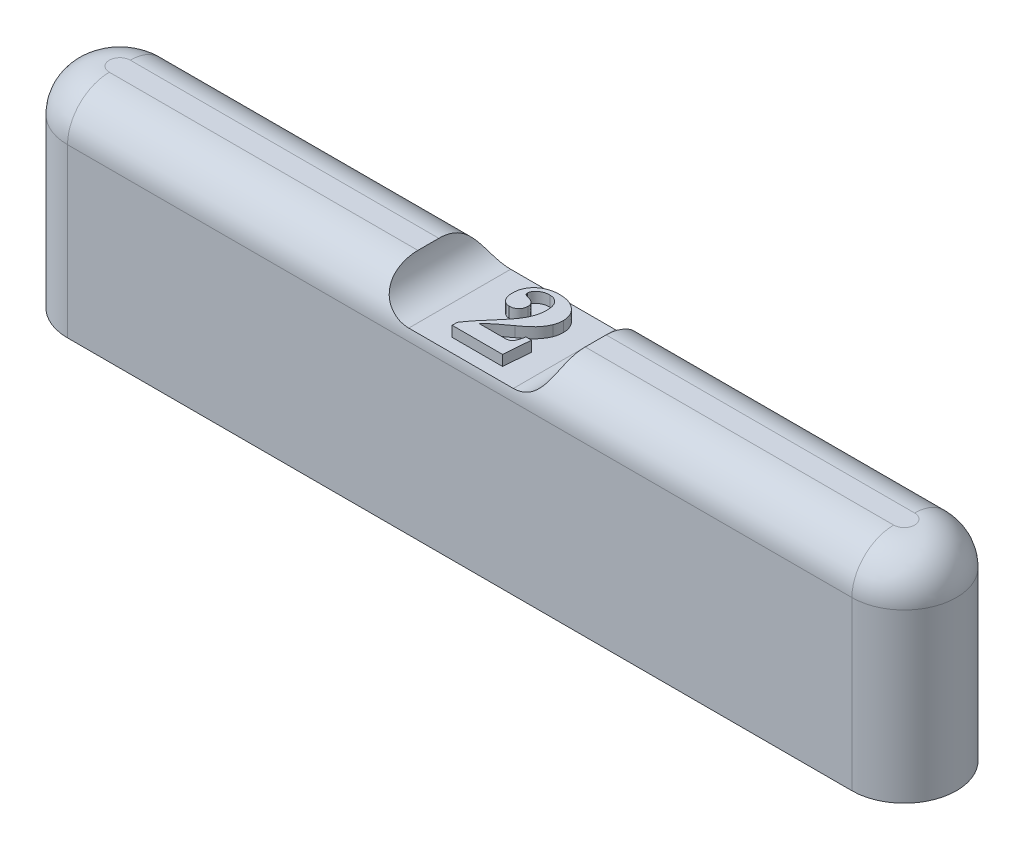
from build123d import *

# Parameters (mm, degrees)
BOSS_EXTRUDE1_DEPTH     = 20
FILLET1_R               = 4
SKETCH2_R               = 2.75
CUT_EXTRUDE1_DEPTH      = 1.5
LPATTERN1_COUNT         = 3
LPATTERN1_PITCH         = 30
CUT_EXTRUDE2_DEPTH      = 48.236109069
CUT_EXTRUDE2_DEPTH_BACK = 48.236109069
WRAP1_DEPTH             = 1


# Read off the part's stored shape, not the designer's step: Wrap1
with BuildPart() as part:
    # Sketch1 → Boss-Extrude1 (new body)
    with BuildSketch(Plane(origin=(0, 0, 0), x_dir=(1, 0, 0), z_dir=(0, 1, 0))):
        with BuildLine():
            Line((37.5, -5), (-37.5, -5))
            ThreePointArc((-37.5, -5), (-42.5, 0), (-37.5, 5))
            Line((-37.5, 5), (37.5, 5))
            ThreePointArc((37.5, 5), (42.5, 0), (37.5, -5))
        make_face()
    extrude(amount=BOSS_EXTRUDE1_DEPTH)

    # Fillet1
    fillet1_edges = [part.edges().sort_by_distance(p)[0] for p in [
        (-42.5, 20, 0),
        (0, 20, 5),
        (42.5, 20, 0),
        (0, 20, -5),
    ]]
    fillet(fillet1_edges, radius=FILLET1_R)

    # Sketch2 → Cut-Extrude1 (cut)
    with BuildSketch(Plane.XZ):
        with Locations(Location((-37.5, 0, 0), (0, 0, 270))):
            Circle(SKETCH2_R)
    cut_extrude1 = extrude(amount=-CUT_EXTRUDE1_DEPTH, mode=Mode.SUBTRACT)

    # LPattern1: Cut-Extrude1 ×3
    with Locations(*[(i * LPATTERN1_PITCH, 0, 0) for i in range(1, LPATTERN1_COUNT)]):
        add(cut_extrude1, mode=Mode.SUBTRACT)

    # Sketch3 → Cut-Extrude2 (cut, two sides: drawn at the far end of the back side and taken through both)
    with BuildSketch(Plane.XY.offset(-CUT_EXTRUDE2_DEPTH_BACK)):
        with BuildLine():
            Line((-5, 23), (5, 23))
            ThreePointArc((5, 23), (8, 20), (5, 17))
            Line((5, 17), (-5, 17))
            ThreePointArc((-5, 17), (-8, 20), (-5, 23))
        make_face()
    extrude(amount=CUT_EXTRUDE2_DEPTH + CUT_EXTRUDE2_DEPTH_BACK, mode=Mode.SUBTRACT)

    # Wrap1 outline → Wrap1 (add)
    with BuildSketch(Plane(origin=(0, 17, 0), x_dir=(1, 0, 0), z_dir=(0, 1, 0))):
        with BuildLine():
            add(Edge.make_bspline(
                [(1.477179672, -2.131048558), (1.531961531, -2.129025799), (1.636756934, -2.125156347), (1.784042683, -2.083710764), (1.912739128, -2.017798162), (2.002734413, -1.937441096), (2.063880351, -1.856422731), (2.108803156, -1.780024303), (2.151677105, -1.688112446), (2.192727948, -1.580807318), (2.232736726, -1.458316815), (2.27140835, -1.320528166), (2.305449427, -1.166588854), (2.327738483, -1.058958074), (2.339359159, -1.00284343)],
                knots=[0, 0, 0, 0, 0.10403341, 0.199011557, 0.288612319, 0.377191825, 0.425797175, 0.481425289, 0.545557079, 0.61863331, 0.699984683, 0.790771883, 0.890916323, 1, 1, 1, 1], degree=3))
            Line((1.477179672, -2.131048558), (-0.993974174, -2.131048558))
            add(Edge.make_bspline(
                [(0.868205313, -0.597394712), (0.79621048, -0.649910777), (0.657741061, -0.750916207), (0.456580944, -0.893601927), (0.27646951, -1.029215281), (0.111636193, -1.150958881), (-0.034458066, -1.262447791), (-0.163409095, -1.362077669), (-0.274143139, -1.450060052), (-0.45325139, -1.598443158), (-0.698599089, -1.817172559), (-0.896074552, -2.027016962), (-0.993974174, -2.131048558)],
                knots=[0, 0, 0, 0, 0.110593572, 0.212707314, 0.306051588, 0.390379305, 0.467018215, 0.534117187, 0.592614819, 0.642525788, 0.822780058, 1, 1, 1, 1], degree=3))
            add(Edge.make_bspline(
                [(2.611795057, 1.311259134), (2.575402231, 1.227702286), (2.503450629, 1.062503542), (2.369097378, 0.829017261), (2.221591228, 0.607376082), (2.079695352, 0.434265273), (1.953675403, 0.296924311), (1.842689454, 0.188702281), (1.717579256, 0.073349805), (1.577787564, -0.048748331), (1.422213899, -0.176924213), (1.250181802, -0.310729341), (1.06539278, -0.453791096), (0.935229638, -0.548583621), (0.868205313, -0.597394712)],
                knots=[0, 0, 0, 0, 0.10413489, 0.205883221, 0.307528832, 0.408265615, 0.461433854, 0.520606469, 0.585444086, 0.656004792, 0.732803839, 0.815893726, 0.905198979, 1, 1, 1, 1], degree=3))
            add(Edge.make_bspline(
                [(2.767243775, 2.136579647), (2.765476042, 2.062762359), (2.762016076, 1.918280503), (2.73244702, 1.70614551), (2.6833885, 1.503661888), (2.635496742, 1.374955883), (2.611795057, 1.311259134)],
                knots=[0, 0, 0, 0, 0.261979501, 0.512769921, 0.758869279, 1, 1, 1, 1], degree=3))
            add(Edge.make_bspline(
                [(0.446730954, 4.125361698), (0.531185697, 4.123275975), (0.696746898, 4.119187219), (0.939241519, 4.094203646), (1.169092432, 4.04891417), (1.386926246, 3.987244257), (1.590639541, 3.904356397), (1.783380165, 3.807151368), (1.961901465, 3.688660444), (2.12755051, 3.554901637), (2.277544806, 3.408600033), (2.408670906, 3.251890691), (2.519920579, 3.086706843), (2.609878279, 2.912173499), (2.68146261, 2.730376132), (2.730374873, 2.539782347), (2.762493821, 2.341195944), (2.765641094, 2.205619187), (2.767243775, 2.136579647)],
                knots=[0, 0, 0, 0, 0.074102612, 0.14526736, 0.21355926, 0.279416432, 0.343556942, 0.406228654, 0.468492489, 0.531146675, 0.592790073, 0.652016559, 0.710119813, 0.767135501, 0.823967905, 0.881147087, 0.939476717, 1, 1, 1, 1], degree=3))
            add(Edge.make_bspline(
                [(-1.397820328, 3.42664375), (-1.339685121, 3.482468658), (-1.223933781, 3.593620027), (-1.029988725, 3.73621049), (-0.821845174, 3.857829356), (-0.597170186, 3.955349696), (-0.357859278, 4.032519936), (-0.102825371, 4.086723136), (0.167059066, 4.118844208), (0.3520908, 4.123156198), (0.446730954, 4.125361698)],
                knots=[0, 0, 0, 0, 0.119107626, 0.23715177, 0.355050392, 0.47498588, 0.598670295, 0.726365388, 0.860041186, 1, 1, 1, 1], degree=3))
            add(Edge.make_bspline(
                [(-1.950704943, 2.013182211), (-1.949501261, 2.082193438), (-1.947130604, 2.218111311), (-1.918428152, 2.417004203), (-1.875210504, 2.607330065), (-1.816463805, 2.790033991), (-1.737178724, 2.962937631), (-1.641872629, 3.127763446), (-1.530076028, 3.284407224), (-1.442173454, 3.378943465), (-1.397820328, 3.42664375)],
                knots=[0, 0, 0, 0, 0.132803649, 0.26155729, 0.386082589, 0.508400008, 0.630401232, 0.751619273, 0.874674186, 1, 1, 1, 1], degree=3))
            add(Edge.make_bspline(
                [(-1.011602379, 0.740746314), (-1.076799531, 0.74447446), (-1.204521956, 0.751777966), (-1.386461074, 0.818290605), (-1.550070508, 0.925271117), (-1.69322001, 1.073400563), (-1.811500845, 1.259061279), (-1.890938186, 1.482580071), (-1.943991337, 1.736660149), (-1.9483889, 1.917788326), (-1.950704943, 2.013182211)],
                knots=[0, 0, 0, 0, 0.110139331, 0.215764983, 0.323707128, 0.438906263, 0.562183724, 0.693638164, 0.838649921, 1, 1, 1, 1], degree=3))
            add(Edge.make_bspline(
                [(-0.104551097, 1.612541186), (-0.107433277, 1.55184237), (-0.113041089, 1.433741609), (-0.162702617, 1.264530911), (-0.246008733, 1.112720856), (-0.36059696, 0.981658482), (-0.497861102, 0.874736466), (-0.653954588, 0.794785259), (-0.828098239, 0.750308211), (-0.94939653, 0.74398769), (-1.011602379, 0.740746314)],
                knots=[0, 0, 0, 0, 0.129242333, 0.251464839, 0.372304265, 0.495878621, 0.620081591, 0.741344555, 0.867352775, 1, 1, 1, 1], degree=3))
            add(Edge.make_bspline(
                [(-0.764807507, 2.352925801), (-0.712490789, 2.337787093), (-0.613060164, 2.309015197), (-0.477694691, 2.245410486), (-0.363497683, 2.17010385), (-0.266944344, 2.084386734), (-0.194142589, 1.983320843), (-0.142356861, 1.870047676), (-0.108753882, 1.745331032), (-0.105978345, 1.657636068), (-0.104551097, 1.612541186)],
                knots=[0, 0, 0, 0, 0.151156851, 0.287281401, 0.413669873, 0.530293514, 0.644009236, 0.756908248, 0.874996313, 1, 1, 1, 1], degree=3))
            add(Edge.make_bspline(
                [(-1.151025456, 2.508374519), (-1.133287913, 2.494836068), (-1.091141008, 2.462666798), (-1.005178361, 2.42780874), (-0.895290257, 2.386647547), (-0.811045884, 2.364875571), (-0.764807507, 2.352925801)],
                knots=[0, 0, 0, 0, 0.159109439, 0.378066483, 0.65864549, 1, 1, 1, 1], degree=3))
            add(Edge.make_bspline(
                [(-1.232756225, 2.707092468), (-1.232081899, 2.687184305), (-1.230781196, 2.648783562), (-1.21372537, 2.594957911), (-1.188222188, 2.546850656), (-1.163446829, 2.521223132), (-1.151025456, 2.508374519)],
                knots=[0, 0, 0, 0, 0.268945253, 0.518766978, 0.758729042, 1, 1, 1, 1], degree=3))
            add(Edge.make_bspline(
                [(-0.00038443, 3.612541186), (-0.085081224, 3.608833937), (-0.24886475, 3.601664997), (-0.483889311, 3.546755047), (-0.696299395, 3.452253769), (-0.880349687, 3.323453619), (-1.031886602, 3.177298589), (-1.146772165, 3.025778423), (-1.218404743, 2.867863556), (-1.228074056, 2.759544014), (-1.232756225, 2.707092468)],
                knots=[0, 0, 0, 0, 0.151816317, 0.293576777, 0.429964406, 0.566304914, 0.694365033, 0.806085808, 0.906100976, 1, 1, 1, 1], degree=3))
            add(Edge.make_bspline(
                [(1.126218134, 2.202284775), (1.125419382, 2.258418172), (1.123872297, 2.367141747), (1.108484739, 2.524352927), (1.087625139, 2.671598252), (1.052679442, 2.807704167), (1.012774581, 2.935365364), (0.958393781, 3.050865278), (0.898520263, 3.157786792), (0.826714952, 3.252443042), (0.749134805, 3.338292119), (0.661001364, 3.410228111), (0.568127793, 3.473318886), (0.468377407, 3.525349279), (0.360714304, 3.563257103), (0.247252366, 3.592895766), (0.125557638, 3.608210727), (0.042385847, 3.61107055), (-0.00038443, 3.612541186)],
                knots=[0, 0, 0, 0, 0.082284271, 0.159374645, 0.231497254, 0.300083139, 0.36523236, 0.427274673, 0.486932074, 0.544586116, 0.60112786, 0.656190593, 0.710940404, 0.765594865, 0.820607428, 0.877984079, 0.93725451, 1, 1, 1, 1], degree=3))
            add(Edge.make_bspline(
                [(0.714359159, 0.617348878), (0.747261882, 0.682124329), (0.812482722, 0.810524323), (0.894486195, 1.008253415), (0.968284969, 1.205271239), (1.025200713, 1.404323571), (1.07052621, 1.603312874), (1.102444977, 1.802435759), (1.122559216, 2.002082393), (1.124996917, 2.135464326), (1.126218134, 2.202284775)],
                knots=[0, 0, 0, 0, 0.131745637, 0.261150462, 0.388067803, 0.513189353, 0.636374668, 0.758087597, 0.878808958, 1, 1, 1, 1], degree=3))
            add(Edge.make_bspline(
                [(-0.607756225, -1.126240866), (-0.526341272, -1.032411706), (-0.369395008, -0.851534171), (-0.147005377, -0.58818052), (0.052485983, -0.342553042), (0.228461917, -0.115210972), (0.383373607, 0.093014827), (0.514393948, 0.283577403), (0.625301777, 0.454674177), (0.686096112, 0.565722807), (0.714359159, 0.617348878)],
                knots=[0, 0, 0, 0, 0.170005554, 0.327725258, 0.471696803, 0.603008639, 0.721148947, 0.826797124, 0.919478664, 1, 1, 1, 1], degree=3))
            add(Edge.make_bspline(
                [(-2.155833148, -3.076561379), (-2.120077921, -3.019555215), (-2.042967512, -2.896614628), (-1.906171622, -2.707469654), (-1.750693337, -2.493359905), (-1.565930664, -2.262250728), (-1.361697851, -2.006814917), (-1.131972057, -1.731572481), (-0.87885055, -1.434992601), (-0.700428862, -1.231786555), (-0.607756225, -1.126240866)],
                knots=[0, 0, 0, 0, 0.080973991, 0.174630064, 0.280853316, 0.39944862, 0.530692677, 0.674513651, 0.830941638, 1, 1, 1, 1], degree=3))
            Line((-2.155833148, -3.076561379), (-2.155833148, -3.566945994))
            Line((-2.155833148, -3.566945994), (2.664679672, -3.566945994))
            Line((2.664679672, -3.566945994), (2.869807877, -1.00284343))
            Line((2.869807877, -1.00284343), (2.339359159, -1.00284343))
        make_face()
    extrude(amount=WRAP1_DEPTH)


solid = part.part
